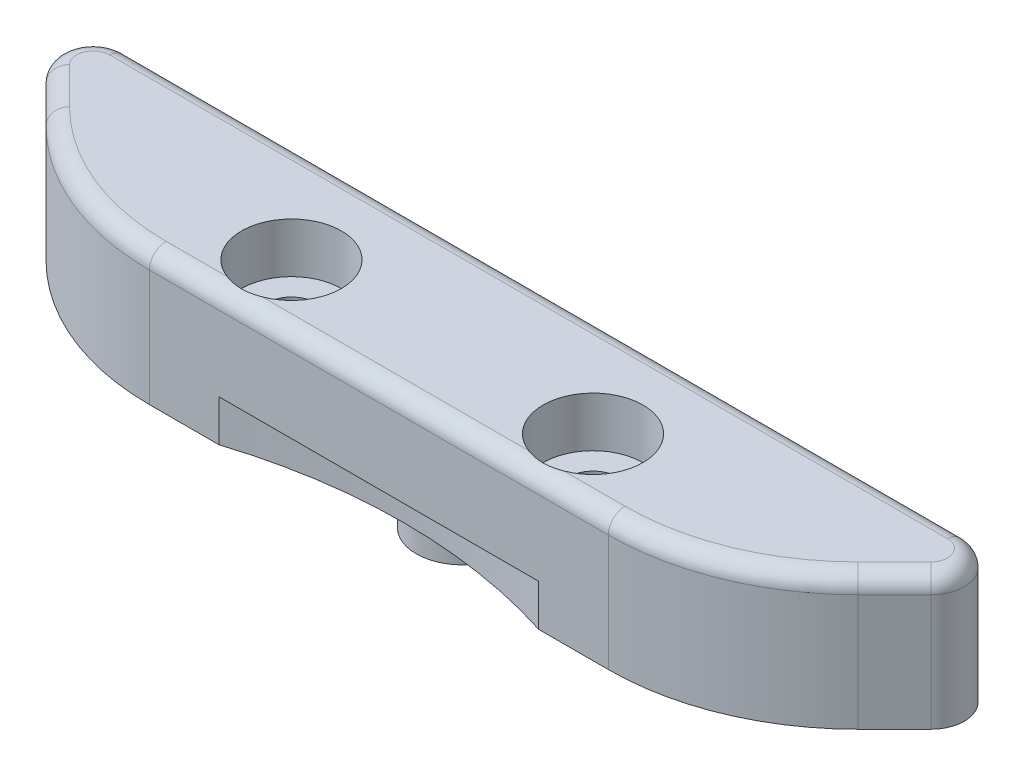
from build123d import *

# Parameters (mm, degrees)
EXTRUDE_1_DEPTH     = 8
SKETCH_4_R          = 31.5
CUT_EXTRUDE_1_DEPTH = 2.5
SKETCH_5_R          = 1.5
CUT_EXTRUDE_2_DEPTH = 51.635955605
SKETCH_6_R          = 3
CUT_EXTRUDE_3_DEPTH = 3
SKETCH_7_R          = 2.75
EXTRUDE_2_DEPTH     = 2
FILLET_1_R          = 15
FILLET_2_R          = 2
FILLET_3_R          = 1


with BuildPart() as part:
    # 草图3 → 凸台-拉伸1 (new body)
    with BuildSketch(Plane(origin=(0, 0, 0), x_dir=(1, 0, 0), z_dir=(0, 1, 0))):
        Polygon((-20, 30), (20, 30), (30, 40), (-30, 40), align=None)
    extrude(amount=EXTRUDE_1_DEPTH)

    # 草图4 → 切除-拉伸1 (cut)
    with BuildSketch(Plane.XZ):
        Circle(SKETCH_4_R)
    extrude(amount=-CUT_EXTRUDE_1_DEPTH, mode=Mode.SUBTRACT)

    # 草图5 → 切除-拉伸2 (cut, through all)
    with BuildSketch(Plane(origin=(0, 8, 0), x_dir=(1, 0, 0), z_dir=(0, 1, 0))):
        with Locations(Location((-9.058666579, 33.80740392, 0), (0, 0, 270))):
            Circle(SKETCH_5_R)
        with Locations(Location((9.058666579, 33.80740392, 0), (0, 0, 90))):
            Circle(SKETCH_5_R)
    extrude(amount=-CUT_EXTRUDE_2_DEPTH, mode=Mode.SUBTRACT)

    # 草图6 → 切除-拉伸3 (cut)
    with BuildSketch(Plane(origin=(0, 8, 0), x_dir=(1, 0, 0), z_dir=(0, 1, 0))):
        with Locations(Location((-9.058666579, 33.80740392, 0), (0, 0, 270))):
            Circle(SKETCH_6_R)
        with Locations(Location((9.058666579, 33.80740392, 0), (0, 0, 270))):
            Circle(SKETCH_6_R)
    extrude(amount=-CUT_EXTRUDE_3_DEPTH, mode=Mode.SUBTRACT)

    # 草图7 → 凸台-拉伸2 (add)
    with BuildSketch(Plane.XZ):
        with Locations(Location((0, -35, 0), (0, 0, 90))):
            Circle(SKETCH_7_R)
    extrude(amount=EXTRUDE_2_DEPTH)

    # 圆角1
    fillet_1_edges = [part.edges().sort_by_distance(p)[0] for p in [
        (20, 4, -30),
        (-20, 4, -30),
    ]]
    fillet(fillet_1_edges, radius=FILLET_1_R)

    # 圆角2
    fillet_2_edges = [part.edges().sort_by_distance(p)[0] for p in [
        (-30, 4, -40),
        (30, 4, -40),
    ]]
    fillet(fillet_2_edges, radius=FILLET_2_R)

    # 圆角3
    # the kernel refuses this fillet: 1 mm, written as the material it takes off along each edge
    with BuildSketch(Plane(origin=(24.393398282, 8, -34.393398282), x_dir=(0, -1, 0), z_dir=(0.7071067811865472, 0, -0.7071067811865478)), Plane(origin=(-26.585786438, 8, -36.585786438), x_dir=(0, -1, 0), z_dir=(0.7071067811865472, 0, 0.7071067811865478))) as fillet_3_piece_1:
        with BuildLine():
            CenterArc((FILLET_3_R, FILLET_3_R), FILLET_3_R, 180, 90)
            Line((0, FILLET_3_R), (0, 0))
            Line((0, 0), (FILLET_3_R, 0))
        make_face()
    extrude(amount=3.100505063, mode=Mode.SUBTRACT)
    with BuildSketch(Plane(origin=(-13.786796564, 8, -30), x_dir=(0, -1, 0), z_dir=(1, 0, 0))) as fillet_3_piece_2:
        with BuildLine():
            CenterArc((FILLET_3_R, FILLET_3_R), FILLET_3_R, 180, 90)
            Line((0, FILLET_3_R), (0, 0))
            Line((0, 0), (FILLET_3_R, 0))
        make_face()
    extrude(amount=27.573593129, mode=Mode.SUBTRACT)
    with BuildSketch(Plane(origin=(-13.786796564, 8, -45), x_dir=(0, 0, 1), z_dir=(1, 0, 0))) as fillet_3_piece_3:
        with BuildLine():
            CenterArc((15 - FILLET_3_R, FILLET_3_R), FILLET_3_R, 270, 90)
            Line((15 - FILLET_3_R, 0), (15, 0))
            Line((15, 0), (15, FILLET_3_R))
        make_face()
    revolve(axis=Axis((-13.786796564, 8, -45), (0, -1, 0)), revolution_arc=45, mode=Mode.SUBTRACT)
    with BuildSketch(Plane(origin=(13.786796564, 8, -45), x_dir=(0, 0, 1), z_dir=(-1, 0, 0))) as fillet_3_piece_4:
        with BuildLine():
            CenterArc((15 - FILLET_3_R, -FILLET_3_R), FILLET_3_R, 0, 90)
            Line((15 - FILLET_3_R, 0), (15, 0))
            Line((15, 0), (15, -FILLET_3_R))
        make_face()
    revolve(axis=Axis((13.786796564, 8, -45), (0, 1, 0)), revolution_arc=45, mode=Mode.SUBTRACT)
    with BuildSketch(Plane(origin=(25.171572875, 8, -40), x_dir=(0, -1, 0), z_dir=(-1, 0, 0))) as fillet_3_piece_5:
        with BuildLine():
            CenterArc((FILLET_3_R, FILLET_3_R), FILLET_3_R, 180, 90)
            Line((0, FILLET_3_R), (0, 0))
            Line((0, 0), (FILLET_3_R, 0))
        make_face()
    extrude(amount=50.343145751, mode=Mode.SUBTRACT)
    with BuildSketch(Plane(origin=(-25.171572875, 8, -38), x_dir=(-0.7071067811865458, 0, 0.7071067811865493), z_dir=(0.7071067811865493, 0, 0.7071067811865458))) as fillet_3_piece_6:
        with BuildLine():
            CenterArc((2 - FILLET_3_R, FILLET_3_R), FILLET_3_R, 270, 90)
            Line((2 - FILLET_3_R, 0), (2, 0))
            Line((2, 0), (2, FILLET_3_R))
        make_face()
    revolve(axis=Axis((-25.171572875, 8, -38), (0, -1, 0)), revolution_arc=135, mode=Mode.SUBTRACT)
    with BuildSketch(Plane(origin=(25.171572875, 8, -38), x_dir=(0, 0, -1), z_dir=(-1, 0, 0))) as fillet_3_piece_7:
        with BuildLine():
            CenterArc((2 - FILLET_3_R, FILLET_3_R), FILLET_3_R, 270, 90)
            Line((2 - FILLET_3_R, 0), (2, 0))
            Line((2, 0), (2, FILLET_3_R))
        make_face()
    revolve(axis=Axis((25.171572875, 8, -38), (0, -1, 0)), revolution_arc=135, mode=Mode.SUBTRACT)


solid = part.part
